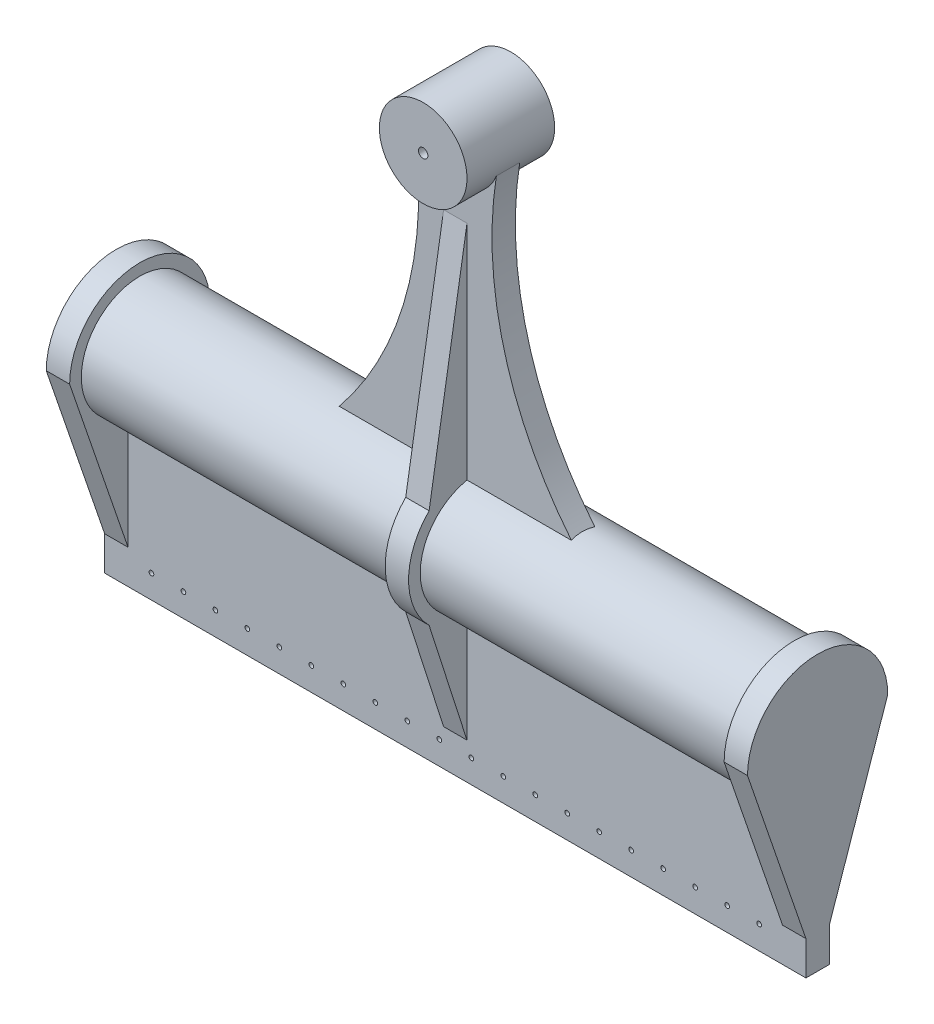
from build123d import *

# Parameters (mm, degrees)
BOSS_EXTRUDE1_DEPTH      = 2.54
BOSS_EXTRUDE1_DEPTH_BACK = 2.54
SKETCH1_W                = 44.45
SKETCH1_H                = 152.4
SKETCH1_R                = 0.508
BOSS_EXTRUDE2_DEPTH      = 76.2
BOSS_EXTRUDE2_DEPTH_BACK = 76.2
SKETCH2_R                = 12.7
BOSS_EXTRUDE3_START      = 71.12
BOSS_EXTRUDE3_DEPTH      = 5.08
BOSS_EXTRUDE4_START      = -76.2
BOSS_EXTRUDE4_DEPTH      = 5.08
BOSS_EXTRUDE5_DEPTH      = 2.54
BOSS_EXTRUDE5_DEPTH_BACK = 2.54
BOSS_EXTRUDE6_DEPTH      = 9.525
BOSS_EXTRUDE6_DEPTH_BACK = 9.525
SKETCH6_R                = 9.525
SKETCH6_R_2              = 1.016
BOSS_EXTRUDE7_DEPTH      = 2.54
BOSS_EXTRUDE7_DEPTH_BACK = 2.54


with BuildPart() as part:
    # Sketch1 → Boss-Extrude1 (new, two sides: drawn at the far end of the back side and taken through both)
    with BuildSketch(Plane(origin=(0, 0, 0), x_dir=(0, 1, 0), z_dir=(0, 0, 1)).offset(-BOSS_EXTRUDE1_DEPTH_BACK)):
        with Locations((-22.225, 0)):
            Rectangle(SKETCH1_W, SKETCH1_H)
        with Locations((-39.37, -66.04)):
            Circle(SKETCH1_R, mode=Mode.SUBTRACT)
        with Locations((-39.37, -59.088421053)):
            Circle(SKETCH1_R, mode=Mode.SUBTRACT)
        with Locations((-39.37, -52.136842105)):
            Circle(SKETCH1_R, mode=Mode.SUBTRACT)
        with Locations((-39.37, -45.185263158)):
            Circle(SKETCH1_R, mode=Mode.SUBTRACT)
        with Locations((-39.37, -38.233684211)):
            Circle(SKETCH1_R, mode=Mode.SUBTRACT)
        with Locations((-39.37, -31.282105263)):
            Circle(SKETCH1_R, mode=Mode.SUBTRACT)
        with Locations((-39.37, -24.330526316)):
            Circle(SKETCH1_R, mode=Mode.SUBTRACT)
        with Locations((-39.37, -17.378947368)):
            Circle(SKETCH1_R, mode=Mode.SUBTRACT)
        with Locations((-39.37, -10.427368421)):
            Circle(SKETCH1_R, mode=Mode.SUBTRACT)
        with Locations((-39.37, -3.475789474)):
            Circle(SKETCH1_R, mode=Mode.SUBTRACT)
        with Locations((-39.37, 3.475789474)):
            Circle(SKETCH1_R, mode=Mode.SUBTRACT)
        with Locations((-39.37, 10.427368421)):
            Circle(SKETCH1_R, mode=Mode.SUBTRACT)
        with Locations((-39.37, 17.378947368)):
            Circle(SKETCH1_R, mode=Mode.SUBTRACT)
        with Locations((-39.37, 24.330526316)):
            Circle(SKETCH1_R, mode=Mode.SUBTRACT)
        with Locations((-39.37, 31.282105263)):
            Circle(SKETCH1_R, mode=Mode.SUBTRACT)
        with Locations((-39.37, 38.233684211)):
            Circle(SKETCH1_R, mode=Mode.SUBTRACT)
        with Locations((-39.37, 45.185263158)):
            Circle(SKETCH1_R, mode=Mode.SUBTRACT)
        with Locations((-39.37, 52.136842105)):
            Circle(SKETCH1_R, mode=Mode.SUBTRACT)
        with Locations((-39.37, 59.088421053)):
            Circle(SKETCH1_R, mode=Mode.SUBTRACT)
        with Locations((-39.37, 66.04)):
            Circle(SKETCH1_R, mode=Mode.SUBTRACT)
    extrude(amount=BOSS_EXTRUDE1_DEPTH + BOSS_EXTRUDE1_DEPTH_BACK)

    # Sketch2 → Boss-Extrude2 (add, two sides: drawn at the far end of the back side and taken through both)
    with BuildSketch(Plane.YZ.offset(-BOSS_EXTRUDE2_DEPTH_BACK)):
        Circle(SKETCH2_R)
    extrude(amount=BOSS_EXTRUDE2_DEPTH + BOSS_EXTRUDE2_DEPTH_BACK)

    # Sketch3 → Boss-Extrude3 (add)
    with BuildSketch(Plane.YZ.offset(BOSS_EXTRUDE3_START)):
        with BuildLine():
            Line((0, 15.24), (-44.45, 0))
            Line((-44.45, 0), (0, -15.24))
            ThreePointArc((0, -15.24), (15.24, 0), (0, 15.24))
        make_face()
    extrude(amount=BOSS_EXTRUDE3_DEPTH)

    # Sketch4 → Boss-Extrude4 (add)
    with BuildSketch(Plane.YZ.offset(BOSS_EXTRUDE4_START)):
        with BuildLine():
            Line((0, 15.24), (-44.45, 0))
            Line((-44.45, 0), (0, -15.24))
            ThreePointArc((0, -15.24), (15.24, 0), (0, 15.24))
        make_face()
    extrude(amount=BOSS_EXTRUDE4_DEPTH)

    # Sketch5 → Boss-Extrude5 (add, two sides: drawn at the far end of the back side and taken through both)
    with BuildSketch(Plane(origin=(0, 0, 0), x_dir=(0, 1, 0), z_dir=(0, 0, 1)).offset(-BOSS_EXTRUDE5_DEPTH_BACK)):
        with BuildLine():
            Line((0, -38.1), (0, 38.1))
            ThreePointArc((0, 38.1), (33.985630195, 12.840847186), (76.2, 9.525))
            Line((76.2, 9.525), (76.2, -9.525))
            ThreePointArc((76.2, -9.525), (33.985630195, -12.840847186), (0, -38.1))
        make_face()
    extrude(amount=BOSS_EXTRUDE5_DEPTH + BOSS_EXTRUDE5_DEPTH_BACK)

    # Sketch6 → Boss-Extrude6 (add, two sides: drawn at the far end of the back side and taken through both)
    with BuildSketch(Plane(origin=(0, 0, 0), x_dir=(0, 1, 0), z_dir=(0, 0, 1)).offset(-BOSS_EXTRUDE6_DEPTH_BACK)):
        with Locations((76.2, 0)):
            Circle(SKETCH6_R)
        with Locations((76.2, 0)):
            Circle(SKETCH6_R_2, mode=Mode.SUBTRACT)
    extrude(amount=BOSS_EXTRUDE6_DEPTH + BOSS_EXTRUDE6_DEPTH_BACK)

    # Sketch7 → Boss-Extrude7 (add, two sides: drawn at the far end of the back side and taken through both)
    with BuildSketch(Plane.YZ.offset(-BOSS_EXTRUDE7_DEPTH_BACK)):
        with BuildLine():
            Line((-44.45, 0), (-10.776307345, 10.776307345))
            ThreePointArc((-10.776307345, 10.776307345), (0, 15.24), (10.776307345, 10.776307345))
            Line((10.776307345, 10.776307345), (76.2, 0))
            Line((76.2, 0), (10.776307345, -10.776307345))
            ThreePointArc((10.776307345, -10.776307345), (0, -15.24), (-10.776307345, -10.776307345))
            Line((-10.776307345, -10.776307345), (-44.45, 0))
        make_face()
    extrude(amount=BOSS_EXTRUDE7_DEPTH + BOSS_EXTRUDE7_DEPTH_BACK)


solid = part.part
